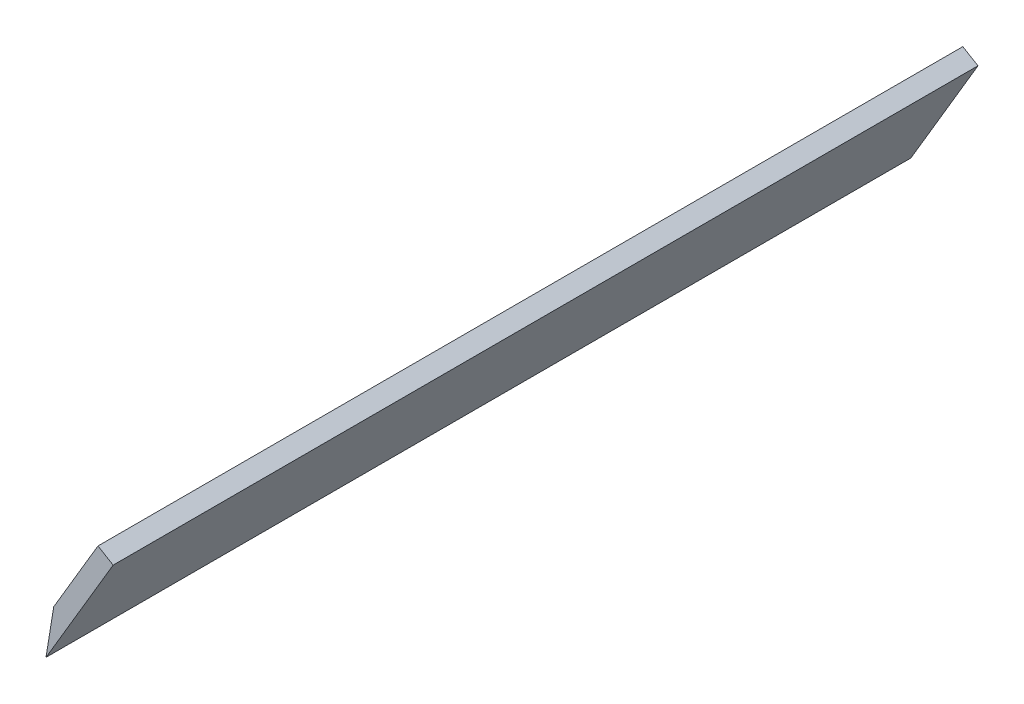
from build123d import *

# Parameters (mm, degrees)
RESSALTO_EXTRUS_O1_DEPTH = 98
CHANFRO1_SIZE            = 2
CORTE_EXTRUS_O1_DEPTH    = 108


with BuildPart() as part:
    # Esboço1 → Ressalto-extrusão1 (new body)
    with BuildSketch(Plane.XY):
        Polygon((0, 0), (-7.610404057, -12.859217835), (-9.331566424, -11.840591257), (-1.721162367, 1.018626578), align=None)
    extrude(amount=RESSALTO_EXTRUS_O1_DEPTH)

    # Chanfro1
    chanfro1_edges = [part.edges().sort_by_distance(p)[0] for p in [
        (-9.331566424, -11.840591257, 49),
    ]]
    chamfer(chanfro1_edges, length=CHANFRO1_SIZE - 0.0001)  # a hair under: the kernel refuses the full size

    # Esboço2 → Corte-extrusão1 (cut)
    with BuildSketch(Plane(origin=(0, 0, 0), x_dir=(-1, 0, 0), z_dir=(0, 0, -1))):
        Polygon((6.735745015, -7.454459757), (7.610404057, -12.859217835), (9.393966164, -10.156838796), align=None)
    extrude(amount=-CORTE_EXTRUS_O1_DEPTH, mode=Mode.SUBTRACT)


solid = part.part
